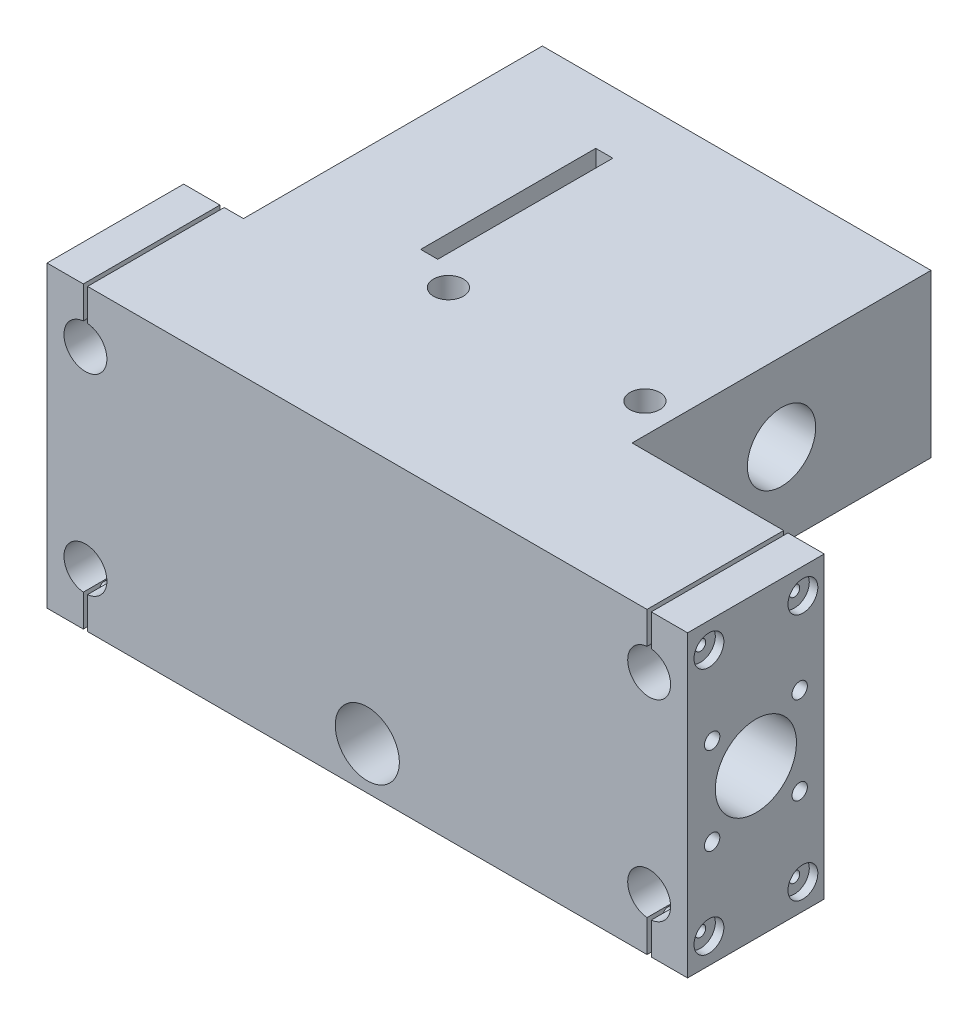
from build123d import *

# Parameters (mm, degrees)
SKETCH1_W                      = 150
SKETCH1_H                      = 70
BOSS_EXTRUDE1_DEPTH            = 32
SKETCH2_R                      = 9.5
LINEAR_BEARING_CUT_1_DEPTH     = 55
Y_AXIS_SHAFTS_CUT_DEPTH        = 169.594187326
LINEAR_BEARING_CUT_2_START     = -55
SKETCH7_R                      = 9.5
LINEAR_BEARING_CUT_2_DEPTH     = 55
SKETCH6_R                      = 6
BETWEEN_BEARINGS_DEPTH         = 123.266103234
SKETCH8_R                      = 3.5
SHAFT_HOLDER_SCREW_CUT_DEPTH   = 4
SKETCH9_R                      = 1.25
SHAFT_HOLDER_SCREW_CUT2_DEPTH  = 20
SHAFT_HOLDER_SCREW_CUT_3_START = -2
SKETCH10_R                     = 3.5
SHAFT_HOLDER_SCREW_CUT_3_DEPTH = 2
SHAFT_HOLDER_SCREW_CUT_4_START = -20
SKETCH11_R                     = 1.25
SHAFT_HOLDER_SCREW_CUT_4_DEPTH = 20
SKETCH12_R                     = 1.8
LINEAR_BEARING_SREW1_DEPTH     = 14
SKETCH13_R                     = 1.85
LINEAR_BEARING_SCREW2_DEPTH    = 14
SKETCH14_R                     = 7.5
CUT_EXTRUDE1_DEPTH             = 169.594187326
SKETCH15_W                     = 60
SKETCH15_H                     = 38
BOSS_EXTRUDE2_DEPTH            = 70
CUT_EXTRUDE3_REACH             = 171.835
SKETCH17_R                     = 3.5
SKETCH18_W                     = 70
SKETCH18_H                     = 38
BOSS_EXTRUDE3_DEPTH            = 31
SKETCH19_R                     = 8
CUT_EXTRUDE4_DEPTH             = 145.308696897
SKETCH20_R                     = 11
SKETCH20_R_2                   = 2.5
CUT_EXTRUDE5_DEPTH             = 31
CUT_EXTRUDE6_REACH             = 171.835
SKETCH21_W                     = 4
SKETCH21_H                     = 41


with BuildPart() as part:
    # Sketch1 → Boss-Extrude1 (new body)
    with BuildSketch(Plane.XY):
        with Locations((-75, -35)):
            Rectangle(SKETCH1_W, SKETCH1_H)
    extrude(amount=BOSS_EXTRUDE1_DEPTH)

    # Sketch2 → Linear_bearing-cut-1 (cut)
    with BuildSketch(Plane.ZY.offset(150)):
        with Locations((16, -35)):
            Circle(SKETCH2_R)
    extrude(amount=-LINEAR_BEARING_CUT_1_DEPTH, mode=Mode.SUBTRACT)

    # Sketch5 → Y-axis-shafts-cut (cut, through all)
    with BuildSketch(Plane.XY.offset(32)):
        with BuildLine():
            Line((-141.5, 0), (-141.5, -7.5))
            ThreePointArc((-141.5, -7.5), (-141, -17.524937811), (-140.5, -7.5))
            Line((-140.5, -7.5), (-140.5, 0))
            Line((-140.5, 0), (-141.5, 0))
        make_face()
        with BuildLine():
            Line((-8.5, 0), (-8.5, -7.5))
            ThreePointArc((-8.5, -7.5), (-9, -17.524937811), (-9.5, -7.5))
            Line((-9.5, -7.5), (-9.5, 0))
            Line((-9.5, 0), (-8.5, 0))
        make_face()
        with BuildLine():
            Line((-141.5, -70), (-141.5, -62.5))
            ThreePointArc((-141.5, -62.5), (-141, -52.475062189), (-140.5, -62.5))
            Line((-140.5, -62.5), (-140.5, -70))
            Line((-140.5, -70), (-141.5, -70))
        make_face()
        with BuildLine():
            Line((-9.5, -70), (-9.5, -62.5))
            ThreePointArc((-9.5, -62.5), (-9, -52.475062189), (-8.5, -62.5))
            Line((-8.5, -62.5), (-8.5, -70))
            Line((-8.5, -70), (-9.5, -70))
        make_face()
    extrude(amount=-Y_AXIS_SHAFTS_CUT_DEPTH, mode=Mode.SUBTRACT)

    # Sketch7 → Linear-bearing-cut-2 (cut)
    with BuildSketch(Plane(origin=(0, 0, 0), x_dir=(0, 0, -1), z_dir=(1, 0, 0)).offset(LINEAR_BEARING_CUT_2_START)):
        with Locations((-16, -35)):
            Circle(SKETCH7_R)
    extrude(amount=LINEAR_BEARING_CUT_2_DEPTH, mode=Mode.SUBTRACT)

    # Sketch6 → between-bearings (cut, through all)
    with BuildSketch(Plane.ZY.offset(95)):
        with Locations((16, -35)):
            Circle(SKETCH6_R)
    extrude(amount=-BETWEEN_BEARINGS_DEPTH, mode=Mode.SUBTRACT)

    # Sketch8 → shaft-holder-screw-cut (cut)
    with BuildSketch(Plane.ZY.offset(150)):
        with Locations((5, -6)):
            Circle(SKETCH8_R)
        with Locations((27, -6)):
            Circle(SKETCH8_R)
        with Locations((27, -64)):
            Circle(SKETCH8_R)
        with Locations((5, -64)):
            Circle(SKETCH8_R)
    extrude(amount=-SHAFT_HOLDER_SCREW_CUT_DEPTH, mode=Mode.SUBTRACT)

    # Sketch9 → shaft-holder-screw-cut2 (cut)
    with BuildSketch(Plane.ZY.offset(146)):
        with Locations((5, -6)):
            Circle(SKETCH9_R)
        with Locations((27, -6)):
            Circle(SKETCH9_R)
        with Locations((5, -64)):
            Circle(SKETCH9_R)
        with Locations((27, -64)):
            Circle(SKETCH9_R)
    extrude(amount=-SHAFT_HOLDER_SCREW_CUT2_DEPTH, mode=Mode.SUBTRACT)

    # Sketch10 → shaft-holder-screw-cut-3 (cut)
    with BuildSketch(Plane(origin=(0, 0, 0), x_dir=(0, 0, -1), z_dir=(1, 0, 0)).offset(SHAFT_HOLDER_SCREW_CUT_3_START)):
        with Locations((-27, -6)):
            Circle(SKETCH10_R)
        with Locations((-5, -6)):
            Circle(SKETCH10_R)
        with Locations((-5, -64)):
            Circle(SKETCH10_R)
        with Locations((-27, -64)):
            Circle(SKETCH10_R)
    extrude(amount=SHAFT_HOLDER_SCREW_CUT_3_DEPTH, mode=Mode.SUBTRACT)

    # Sketch11 → shaft-holder-screw-cut-4 (cut)
    with BuildSketch(Plane(origin=(-2, 0, 0), x_dir=(0, 0, -1), z_dir=(1, 0, 0)).offset(SHAFT_HOLDER_SCREW_CUT_4_START)):
        with Locations((-27, -6)):
            Circle(SKETCH11_R)
        with Locations((-5, -6)):
            Circle(SKETCH11_R)
        with Locations((-5, -64)):
            Circle(SKETCH11_R)
        with Locations((-27, -64)):
            Circle(SKETCH11_R)
    extrude(amount=SHAFT_HOLDER_SCREW_CUT_4_DEPTH, mode=Mode.SUBTRACT)

    # Sketch12 → Linear-bearing-srew1 (cut)
    with BuildSketch(Plane(origin=(0, 0, 0), x_dir=(0, 0, -1), z_dir=(1, 0, 0))):
        with Locations((-5.75, -24.75)):
            Circle(SKETCH12_R)
        with Locations((-26.25, -24.75)):
            Circle(SKETCH12_R)
        with Locations((-5.75, -45.25)):
            Circle(SKETCH12_R)
        with Locations((-26.25, -45.25)):
            Circle(SKETCH12_R)
    extrude(amount=-LINEAR_BEARING_SREW1_DEPTH, mode=Mode.SUBTRACT)

    # Sketch13 → Linear-bearing-screw2 (cut)
    with BuildSketch(Plane.ZY.offset(150)):
        with Locations((27.5, -24.75)):
            Circle(SKETCH13_R)
        with Locations((4.5, -24.75)):
            Circle(SKETCH13_R)
        with Locations((27.5, -45.25)):
            Circle(SKETCH13_R)
        with Locations((4.5, -45.25)):
            Circle(SKETCH13_R)
    extrude(amount=-LINEAR_BEARING_SCREW2_DEPTH, mode=Mode.SUBTRACT)

    # Sketch14 → Cut-Extrude1 (cut, through all)
    with BuildSketch(Plane(origin=(0, 0, 0), x_dir=(-1, 0, 0), z_dir=(0, 0, -1))):
        with Locations((75, -60)):
            Circle(SKETCH14_R)
    extrude(amount=-CUT_EXTRUDE1_DEPTH, mode=Mode.SUBTRACT)

    # Sketch15 → Boss-Extrude2 (add)
    with BuildSketch(Plane(origin=(0, 0, 0), x_dir=(-1, 0, 0), z_dir=(0, 0, -1))):
        with Locations((75, -19)):
            Rectangle(SKETCH15_W, SKETCH15_H)
    extrude(amount=BOSS_EXTRUDE2_DEPTH)

    # Sketch17 → Cut-Extrude3 (cut, up to next)
    with BuildSketch(Plane.XZ.offset(38), mode=Mode.PRIVATE) as cut_extrude3_sk1:
        with Locations((-98, -10)):
            Circle(SKETCH17_R)
    cut_extrude3_tool1 = extrude(cut_extrude3_sk1.sketch, amount=-CUT_EXTRUDE3_REACH, mode=Mode.PRIVATE) & part.part
    # Sketch17 → Cut-Extrude3 (cut, up to next)
    with BuildSketch(Plane.XZ.offset(38), mode=Mode.PRIVATE) as cut_extrude3_sk2:
        with Locations((-52, -10)):
            Circle(SKETCH17_R)
    cut_extrude3_tool2 = extrude(cut_extrude3_sk2.sketch, amount=-CUT_EXTRUDE3_REACH, mode=Mode.PRIVATE) & part.part
    add(cut_extrude3_tool1.solids().sort_by_distance((-98, -38, -10))[0], mode=Mode.SUBTRACT)
    add(cut_extrude3_tool2.solids().sort_by_distance((-52, -38, -10))[0], mode=Mode.SUBTRACT)

    # Sketch18 → Boss-Extrude3 (add)
    with BuildSketch(Plane.ZY.offset(105)):
        with Locations((-35, -19)):
            Rectangle(SKETCH18_W, SKETCH18_H)
    extrude(amount=BOSS_EXTRUDE3_DEPTH)

    # Sketch19 → Cut-Extrude4 (cut, through all)
    with BuildSketch(Plane(origin=(-45, 0, 0), x_dir=(0, 0, -1), z_dir=(1, 0, 0))):
        with Locations((35, -18.3)):
            Circle(SKETCH19_R)
    extrude(amount=-CUT_EXTRUDE4_DEPTH, mode=Mode.SUBTRACT)

    # Sketch20 → Cut-Extrude5 (cut)
    with BuildSketch(Plane.ZY.offset(136)):
        with Locations((-35, -18.3)):
            Circle(SKETCH20_R)
        with Locations((-23.686291501, -6.986291501)):
            Circle(SKETCH20_R_2)
        with Locations((-19, -18.3)):
            Circle(SKETCH20_R_2)
        with Locations((-23.686291501, -29.613708499)):
            Circle(SKETCH20_R_2)
        with Locations((-46.313708499, -6.986291501)):
            Circle(SKETCH20_R_2)
        with Locations((-51, -18.3)):
            Circle(SKETCH20_R_2)
        with Locations((-46.313708499, -29.613708499)):
            Circle(SKETCH20_R_2)
    extrude(amount=-CUT_EXTRUDE5_DEPTH, mode=Mode.SUBTRACT)

    # Sketch21 → Cut-Extrude6 (cut, up to next)
    with BuildSketch(Plane(origin=(0, -38, 0), x_dir=(-1, 0, 0), z_dir=(0, -1, 0)), mode=Mode.PRIVATE) as cut_extrude6_sk1:
        with Locations((107, 35)):
            Rectangle(SKETCH21_W, SKETCH21_H)
    cut_extrude6_tool1 = extrude(cut_extrude6_sk1.sketch, amount=-CUT_EXTRUDE6_REACH, mode=Mode.PRIVATE) & part.part
    add(cut_extrude6_tool1.solids().sort_by_distance((-107, -38, -35))[0], mode=Mode.SUBTRACT)


solid = part.part
